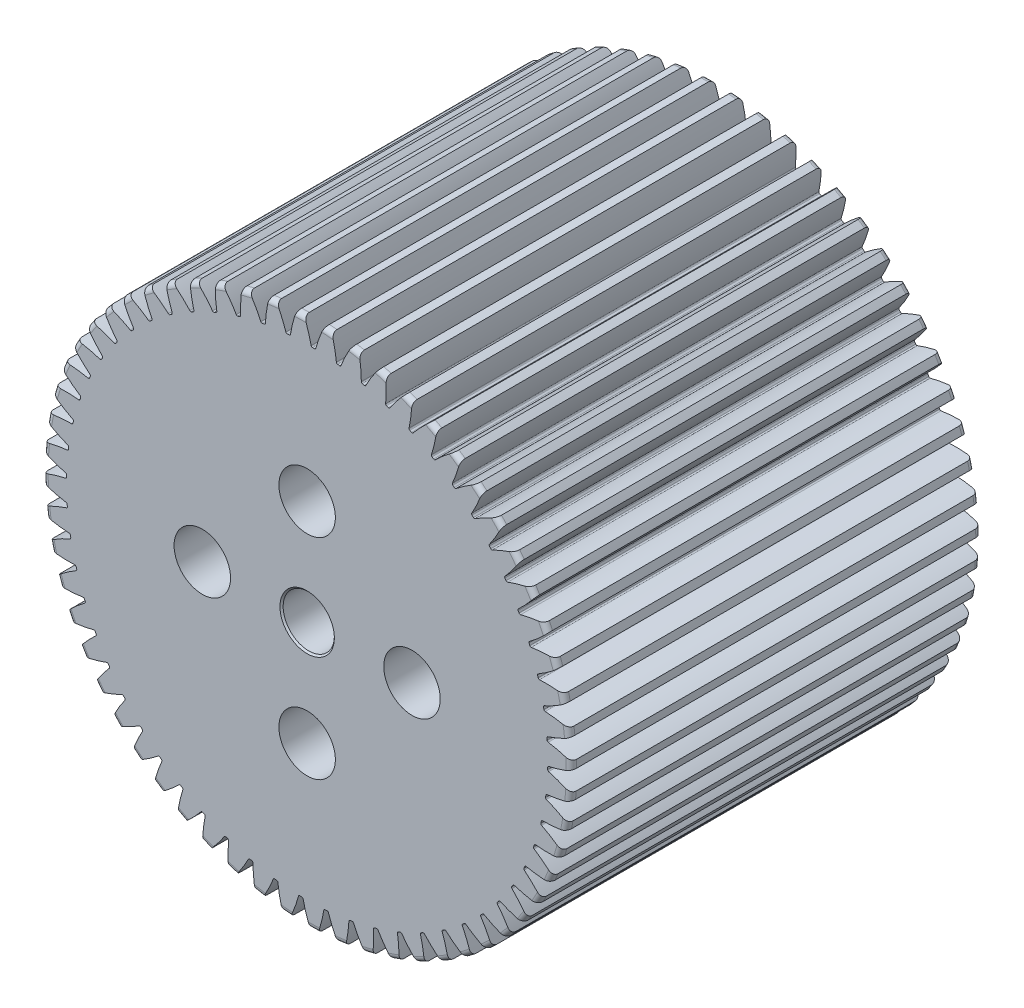
from build123d import *

# Parameters (mm, degrees)
SKETCH1_R                = 32.766
BOSS_EXTRUDE1_DEPTH      = 50.8
FILLET2_R                = 0.65532
CUT_EXTRUDE1_DEPTH       = 69.759446806
FILLET1_R                = 0.166243
CIRPATTERN1_COUNT        = 60
FILLET1_OF_CIRPATTERN1_R = 0.166243
SKETCH5_R                = 3.175
CUT_EXTRUDE2_DEPTH       = 69.757278413
CHAMFER1_SIZE            = 0.2
M6_CLEARANCE_HOLE1_D     = 7


with BuildPart() as part:
    # Sketch1 → Boss-Extrude1 (new body)
    with BuildSketch(Plane.XY):
        Circle(SKETCH1_R)
    extrude(amount=-BOSS_EXTRUDE1_DEPTH)

    # Fillet2
    fillet2_edges = [part.edges().sort_by_distance(p)[0] for p in [
        (-32.766, 0, -50.8),
        (-32.766, 0, 0),
    ]]
    fillet(fillet2_edges, radius=FILLET2_R)

    # Sketch4 → Cut-Extrude1 (cut, through all)
    with BuildSketch(Plane.XY):
        with BuildLine():
            ThreePointArc((1.035968172, 29.817249339), (0.78099738, 29.82501687), (0.525969495, 29.830604156))
            add(Edge.make_bspline(
                [(-7.960962785, 41.047768663), (-0.939186951, 36.805485785), (0.525969495, 29.830604156)],
                knots=[0, 0, 0, 1, 1, 1], degree=2))
            ThreePointArc((-7.960962785, 41.047768663), (1.09452968, 41.798304337), (10.098331755, 40.574868286))
            add(Edge.make_bspline(
                [(10.098331755, 40.574868286), (2.864154615, 36.705891549), (1.035968172, 29.817249339)],
                knots=[0, 0, 0, 1, 1, 1], degree=2))
        make_face()
    cut_extrude1 = extrude(amount=-CUT_EXTRUDE1_DEPTH, mode=Mode.SUBTRACT)

    # Fillet1
    fillet1_edges = [part.edges().sort_by_distance(p)[0] for p in [
        (1.035968172, 29.817249339, -25.4),
        (0.525969495, 29.830604156, -25.4),
    ]]
    fillet(fillet1_edges, radius=FILLET1_R)

    # CirPattern1: Cut-Extrude1 ×60 about axis
    cirpattern1_axis = Axis((0, 0, -50.8), (0, 0, 1))
    for i in range(1, CIRPATTERN1_COUNT):
        add(cut_extrude1.rotate(cirpattern1_axis, i * 360 / CIRPATTERN1_COUNT), mode=Mode.SUBTRACT)

    # Fillet1 of CirPattern1
    fillet1_of_cirpattern1_edges = [part.edges().sort_by_distance(p)[0] for p in [
        (-2.086458222, 29.762195489, -25.4),
        (-2.595059032, 29.722167768, -25.4),
        (-5.186024943, 29.381060796, -25.4),
        (-5.687655548, 29.288089091, -25.4),
        (-8.22877249, 28.678021053, -25.4),
        (-8.717936921, 28.53312398, -25.4),
        (-11.181363884, 27.66077891, -25.4),
        (-11.652702752, 27.465543992, -25.4),
        (-14.011449915, 26.340479485, -25.4),
        (-14.459799134, 26.097045757, -25.4),
        (-16.688023569, 24.731588255, -25.4),
        (-17.10847093, 24.442622827, -25.4),
        (-19.181759744, 22.851732568, -25.4),
        (-19.569698738, 22.520401407, -25.4),
        (-21.465336545, 20.721508517, -25.4),
        (-21.816516832, 20.351441756, -25.4),
        (-23.513734627, 18.364255283, -25.4),
        (-23.824308602, 17.95950745, -25.4),
        (-25.304511313, 15.805799425, -25.4),
        (-25.571076262, 15.370805022, -25.4),
        (-26.818046477, 13.07417192, -25.4),
        (-27.037681859, 12.613696838, -25.4),
        (-28.037757511, 10.199301052, -25.4),
        (-28.208056955, 9.718390352, -25.4),
        (-28.950281007, 7.212684508, -25.4),
        (-29.069378677, 6.716607148, -25.4),
        (-29.545619167, 4.147044283, -25.4),
        (-29.612210202, 3.64123539, -25.4),
        (-29.817249339, 1.035968172, -25.4),
        (-29.830604156, 0.525969495, -25.4),
        (-29.762195489, -2.086458222, -25.4),
        (-29.722167768, -2.595059032, -25.4),
        (-29.381060796, -5.186024943, -25.4),
        (-29.288089091, -5.687655548, -25.4),
        (-28.678021053, -8.22877249, -25.4),
        (-28.53312398, -8.717936921, -25.4),
        (-27.66077891, -11.181363884, -25.4),
        (-27.465543992, -11.652702752, -25.4),
        (-26.340479485, -14.011449915, -25.4),
        (-26.097045757, -14.459799134, -25.4),
        (-24.731588255, -16.688023569, -25.4),
        (-24.442622827, -17.10847093, -25.4),
        (-22.851732568, -19.181759744, -25.4),
        (-22.520401407, -19.569698738, -25.4),
        (-20.721508517, -21.465336545, -25.4),
        (-20.351441756, -21.816516832, -25.4),
        (-18.364255283, -23.513734627, -25.4),
        (-17.95950745, -23.824308602, -25.4),
        (-15.805799425, -25.304511313, -25.4),
        (-15.370805022, -25.571076262, -25.4),
        (-13.07417192, -26.818046477, -25.4),
        (-12.613696838, -27.037681859, -25.4),
        (-10.199301052, -28.037757511, -25.4),
        (-9.718390352, -28.208056955, -25.4),
        (-7.212684508, -28.950281007, -25.4),
        (-6.716607148, -29.069378677, -25.4),
        (-4.147044283, -29.545619167, -25.4),
        (-3.64123539, -29.612210202, -25.4),
        (-1.035968172, -29.817249339, -25.4),
        (-0.525969495, -29.830604156, -25.4),
        (2.086458222, -29.762195489, -25.4),
        (2.595059032, -29.722167768, -25.4),
        (5.186024943, -29.381060796, -25.4),
        (5.687655548, -29.288089091, -25.4),
        (8.22877249, -28.678021053, -25.4),
        (8.717936921, -28.53312398, -25.4),
        (11.181363884, -27.66077891, -25.4),
        (11.652702752, -27.465543992, -25.4),
        (14.011449915, -26.340479485, -25.4),
        (14.459799134, -26.097045757, -25.4),
        (16.688023569, -24.731588255, -25.4),
        (17.10847093, -24.442622827, -25.4),
        (19.181759744, -22.851732568, -25.4),
        (19.569698738, -22.520401407, -25.4),
        (21.465336545, -20.721508517, -25.4),
        (21.816516832, -20.351441756, -25.4),
        (23.513734627, -18.364255283, -25.4),
        (23.824308602, -17.95950745, -25.4),
        (25.304511313, -15.805799425, -25.4),
        (25.571076262, -15.370805022, -25.4),
        (26.818046477, -13.07417192, -25.4),
        (27.037681859, -12.613696838, -25.4),
        (28.037757511, -10.199301052, -25.4),
        (28.208056955, -9.718390352, -25.4),
        (28.950281007, -7.212684508, -25.4),
        (29.069378677, -6.716607148, -25.4),
        (29.545619167, -4.147044283, -25.4),
        (29.612210202, -3.64123539, -25.4),
        (29.817249339, -1.035968172, -25.4),
        (29.830604156, -0.525969495, -25.4),
        (29.762195489, 2.086458222, -25.4),
        (29.722167768, 2.595059032, -25.4),
        (29.381060796, 5.186024943, -25.4),
        (29.288089091, 5.687655548, -25.4),
        (28.678021053, 8.22877249, -25.4),
        (28.53312398, 8.717936921, -25.4),
        (27.66077891, 11.181363884, -25.4),
        (27.465543992, 11.652702752, -25.4),
        (26.340479485, 14.011449915, -25.4),
        (26.097045757, 14.459799134, -25.4),
        (24.731588255, 16.688023569, -25.4),
        (24.442622827, 17.10847093, -25.4),
        (22.851732568, 19.181759744, -25.4),
        (22.520401407, 19.569698738, -25.4),
        (20.721508517, 21.465336545, -25.4),
        (20.351441756, 21.816516832, -25.4),
        (18.364255283, 23.513734627, -25.4),
        (17.95950745, 23.824308602, -25.4),
        (15.805799425, 25.304511313, -25.4),
        (15.370805022, 25.571076262, -25.4),
        (13.07417192, 26.818046477, -25.4),
        (12.613696838, 27.037681859, -25.4),
        (10.199301052, 28.037757511, -25.4),
        (9.718390352, 28.208056955, -25.4),
        (7.212684508, 28.950281007, -25.4),
        (6.716607148, 29.069378677, -25.4),
        (4.147044283, 29.545619167, -25.4),
        (3.64123539, 29.612210202, -25.4),
    ]]
    fillet(fillet1_of_cirpattern1_edges, radius=FILLET1_OF_CIRPATTERN1_R)

    # Sketch5 → Cut-Extrude2 (cut, through all)
    with BuildSketch(Plane.XY):
        Circle(SKETCH5_R)
    extrude(amount=-CUT_EXTRUDE2_DEPTH, mode=Mode.SUBTRACT)

    # Chamfer1
    chamfer1_edges = [part.edges().sort_by_distance(p)[0] for p in [
        (-3.175, 0, 0),
    ]]
    chamfer(chamfer1_edges, length=CHAMFER1_SIZE)

    # M6 Clearance Hole1 (through all)
    with Locations(Plane(origin=(0, 0, -50.8), x_dir=(1, 0, 0), z_dir=(0, 0, -1))):
        with Locations((0, -13), (13, 0), (0, 13), (-13, 0)):
            Hole(M6_CLEARANCE_HOLE1_D / 2)


solid = part.part
